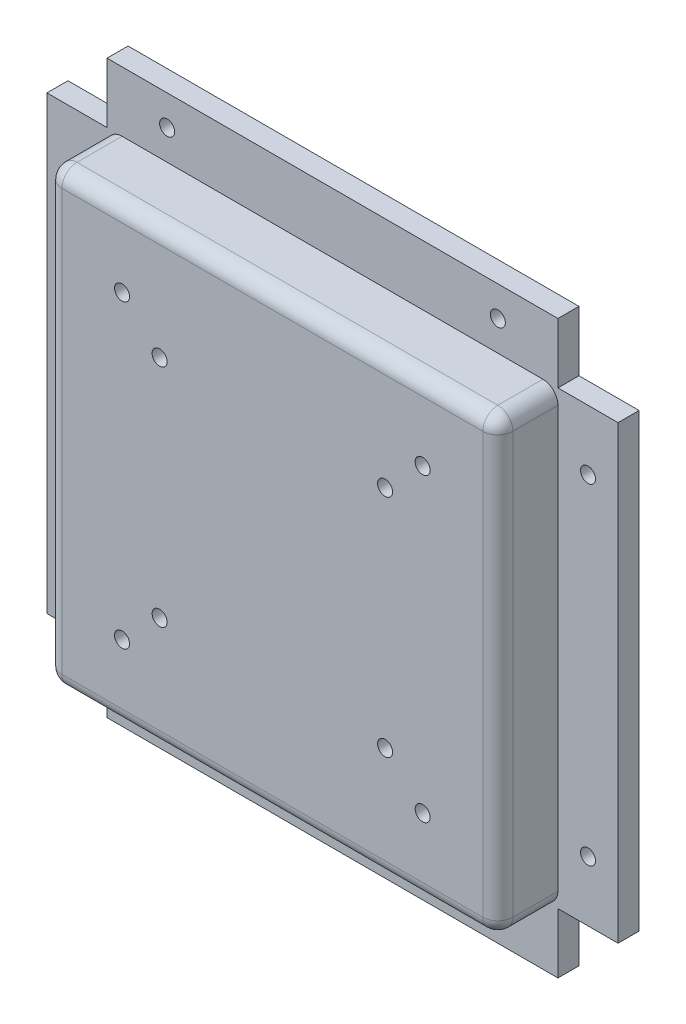
from build123d import *

# Parameters (mm, degrees)
SKETCH1_W           = 150
SKETCH1_H           = 150
BASE_FLANGE1_DEPTH  = 7
SKETCH23_W          = 150
SKETCH23_H          = 150
SKETCH23_W_2        = 130
SKETCH23_H_2        = 130
BOSS_EXTRUDE3_DEPTH = 20
SKETCH27_W          = 7
SKETCH27_H          = 150
BOSS_EXTRUDE4_DEPTH = 20
SKETCH28_W          = 150
SKETCH28_H          = 7
BOSS_EXTRUDE5_DEPTH = 20
SKETCH29_W          = 7
SKETCH29_H          = 150
BOSS_EXTRUDE6_DEPTH = 20
SKETCH30_W          = 150
SKETCH30_H          = 7
BOSS_EXTRUDE7_DEPTH = 20
SKETCH31_R          = 2.5
CUT_EXTRUDE1_DEPTH  = 20
SKETCH32_R          = 2.5
CUT_EXTRUDE2_DEPTH  = 20
FILLET1_R           = 5


# Sheet-metal steps are written as plain solids
with BuildPart() as part:
    # Sketch1 → Base-Flange1 (new body)
    with BuildSketch(Plane.XY):
        Rectangle(SKETCH1_W, SKETCH1_H)
    extrude(amount=-BASE_FLANGE1_DEPTH)

    # Sketch23 → Boss-Extrude3 (add)
    with BuildSketch(Plane(origin=(0, 0, -7), x_dir=(-1, 0, 0), z_dir=(0, 0, -1))):
        Rectangle(SKETCH23_W, SKETCH23_H)
        Rectangle(SKETCH23_W_2, SKETCH23_H_2, mode=Mode.SUBTRACT)
    extrude(amount=BOSS_EXTRUDE3_DEPTH)

    # Sketch27 → Boss-Extrude4 (add)
    with BuildSketch(Plane(origin=(75, 0, 0), x_dir=(0, 0, -1), z_dir=(1, 0, 0))):
        with Locations((23.5, 0)):
            Rectangle(SKETCH27_W, SKETCH27_H)
    extrude(amount=BOSS_EXTRUDE4_DEPTH)

    # Sketch28 → Boss-Extrude5 (add)
    with BuildSketch(Plane(origin=(0, -75, 0), x_dir=(-1, 0, 0), z_dir=(0, -1, 0))):
        with Locations((0, 23.5)):
            Rectangle(SKETCH28_W, SKETCH28_H)
    extrude(amount=BOSS_EXTRUDE5_DEPTH)

    # Sketch29 → Boss-Extrude6 (add)
    with BuildSketch(Plane.ZY.offset(75)):
        with Locations((-23.5, 0)):
            Rectangle(SKETCH29_W, SKETCH29_H)
    extrude(amount=BOSS_EXTRUDE6_DEPTH)

    # Sketch30 → Boss-Extrude7 (add)
    with BuildSketch(Plane(origin=(0, 75, 0), x_dir=(1, 0, 0), z_dir=(0, 1, 0))):
        with Locations((0, 23.5)):
            Rectangle(SKETCH30_W, SKETCH30_H)
    extrude(amount=BOSS_EXTRUDE7_DEPTH)

    # Sketch31 → Cut-Extrude1 (cut)
    with BuildSketch(Plane.XY):
        with Locations((-50, -50)):
            Circle(SKETCH31_R)
        with Locations((-50, 50)):
            Circle(SKETCH31_R)
        with Locations((50, 50)):
            Circle(SKETCH31_R)
        with Locations((50, -50)):
            Circle(SKETCH31_R)
        with Locations((37.5, 37.5)):
            Circle(SKETCH31_R)
        with Locations((-37.5, 37.5)):
            Circle(SKETCH31_R)
        with Locations((37.5, -37.5)):
            Circle(SKETCH31_R)
        with Locations((-37.5, -37.5)):
            Circle(SKETCH31_R)
    extrude(amount=-CUT_EXTRUDE1_DEPTH, mode=Mode.SUBTRACT)

    # Sketch32 → Cut-Extrude2 (cut)
    with BuildSketch(Plane.XY.offset(-20)):
        with Locations((85, 55)):
            Circle(SKETCH32_R)
        with Locations((85, -55)):
            Circle(SKETCH32_R)
        with Locations((55, -85)):
            Circle(SKETCH32_R)
        with Locations((-55, -85)):
            Circle(SKETCH32_R)
        with Locations((-85, -55)):
            Circle(SKETCH32_R)
        with Locations((-85, 55)):
            Circle(SKETCH32_R)
        with Locations((-55, 85)):
            Circle(SKETCH32_R)
        with Locations((55, 85)):
            Circle(SKETCH32_R)
    extrude(amount=-CUT_EXTRUDE2_DEPTH, mode=Mode.SUBTRACT)

    # Fillet1
    # the kernel refuses this fillet: 5 mm, written as the material it takes off along each edge
    with BuildSketch(Plane(origin=(70, -70, -5), x_dir=(0, 0, 1), z_dir=(0, -1, 0))) as fillet1_piece_1_section:
        Polygon((0, 0), (FILLET1_R, 0), (FILLET1_R, -FILLET1_R), (0, -FILLET1_R), align=None)
    fillet1_piece_1 = extrude(amount=FILLET1_R, mode=Mode.PRIVATE)
    fillet1_piece_1 = fillet1_piece_1 - Plane(origin=(70, -70, -5), x_dir=(-0.7071067811865475, 0, -0.7071067811865475), z_dir=(0, -1, 0)) * Sphere(FILLET1_R, mode=Mode.PRIVATE)
    add(fillet1_piece_1, mode=Mode.SUBTRACT)
    with BuildSketch(Plane(origin=(70, 70, -5), x_dir=(1, 0, 0), z_dir=(0, 0, 1))) as fillet1_piece_2_section:
        Polygon((0, 0), (FILLET1_R, 0), (FILLET1_R, FILLET1_R), (0, FILLET1_R), align=None)
    fillet1_piece_2 = extrude(amount=FILLET1_R, mode=Mode.PRIVATE)
    fillet1_piece_2 = fillet1_piece_2 - Plane(origin=(70, 70, -5), x_dir=(-0.7071067811865475, -0.7071067811865475, 0), z_dir=(0, 0, 1)) * Sphere(FILLET1_R, mode=Mode.PRIVATE)
    add(fillet1_piece_2, mode=Mode.SUBTRACT)
    with BuildSketch(Plane(origin=(-70, -70, -5), x_dir=(0, 0, 1), z_dir=(0, -1, 0))) as fillet1_piece_3_section:
        Polygon((0, 0), (FILLET1_R, 0), (FILLET1_R, FILLET1_R), (0, FILLET1_R), align=None)
    fillet1_piece_3 = extrude(amount=FILLET1_R, mode=Mode.PRIVATE)
    fillet1_piece_3 = fillet1_piece_3 - Plane(origin=(-70, -70, -5), x_dir=(0.7071067811865475, 0, -0.7071067811865475), z_dir=(0, -1, 0)) * Sphere(FILLET1_R, mode=Mode.PRIVATE)
    add(fillet1_piece_3, mode=Mode.SUBTRACT)
    with BuildSketch(Plane(origin=(-70, 70, -5), x_dir=(-1, 0, 0), z_dir=(0, 0, 1))) as fillet1_piece_4_section:
        Polygon((0, 0), (FILLET1_R, 0), (FILLET1_R, -FILLET1_R), (0, -FILLET1_R), align=None)
    fillet1_piece_4 = extrude(amount=FILLET1_R, mode=Mode.PRIVATE)
    fillet1_piece_4 = fillet1_piece_4 - Plane(origin=(-70, 70, -5), x_dir=(0.7071067811865475, -0.7071067811865475, 0), z_dir=(0, 0, 1)) * Sphere(FILLET1_R, mode=Mode.PRIVATE)
    add(fillet1_piece_4, mode=Mode.SUBTRACT)
    with BuildSketch(Plane(origin=(75, -75, -20), x_dir=(-1, 0, 0), z_dir=(0, 0, 1)), Plane(origin=(75, 75, -20), x_dir=(0, -1, 0), z_dir=(0, 0, 1)), Plane(origin=(-75, -75, -5), x_dir=(1, 0, 0), z_dir=(0, 0, -1)), Plane(origin=(-75, 75, -5), x_dir=(0, -1, 0), z_dir=(0, 0, -1))) as fillet1_piece_5:
        with BuildLine():
            CenterArc((FILLET1_R, -FILLET1_R), FILLET1_R, 90, 90)
            Line((0, -FILLET1_R), (0, 0))
            Line((0, 0), (FILLET1_R, 0))
        make_face()
    extrude(amount=15, mode=Mode.SUBTRACT)
    with BuildSketch(Plane(origin=(-70, -75, 0), x_dir=(0, 0, -1), z_dir=(1, 0, 0))) as fillet1_piece_6:
        with BuildLine():
            CenterArc((FILLET1_R, FILLET1_R), FILLET1_R, 180, 90)
            Line((0, FILLET1_R), (0, 0))
            Line((0, 0), (FILLET1_R, 0))
        make_face()
    extrude(amount=140, mode=Mode.SUBTRACT)
    with BuildSketch(Plane(origin=(-75, 70, 0), x_dir=(1, 0, 0), z_dir=(0, -1, 0)), Plane(origin=(70, 75, 0), x_dir=(0, -1, 0), z_dir=(-1, 0, 0)), Plane(origin=(75, -70, 0), x_dir=(-1, 0, 0), z_dir=(0, 1, 0))) as fillet1_piece_7:
        with BuildLine():
            CenterArc((FILLET1_R, -FILLET1_R), FILLET1_R, 90, 90)
            Line((0, -FILLET1_R), (0, 0))
            Line((0, 0), (FILLET1_R, 0))
        make_face()
    extrude(amount=140, mode=Mode.SUBTRACT)


solid = part.part
